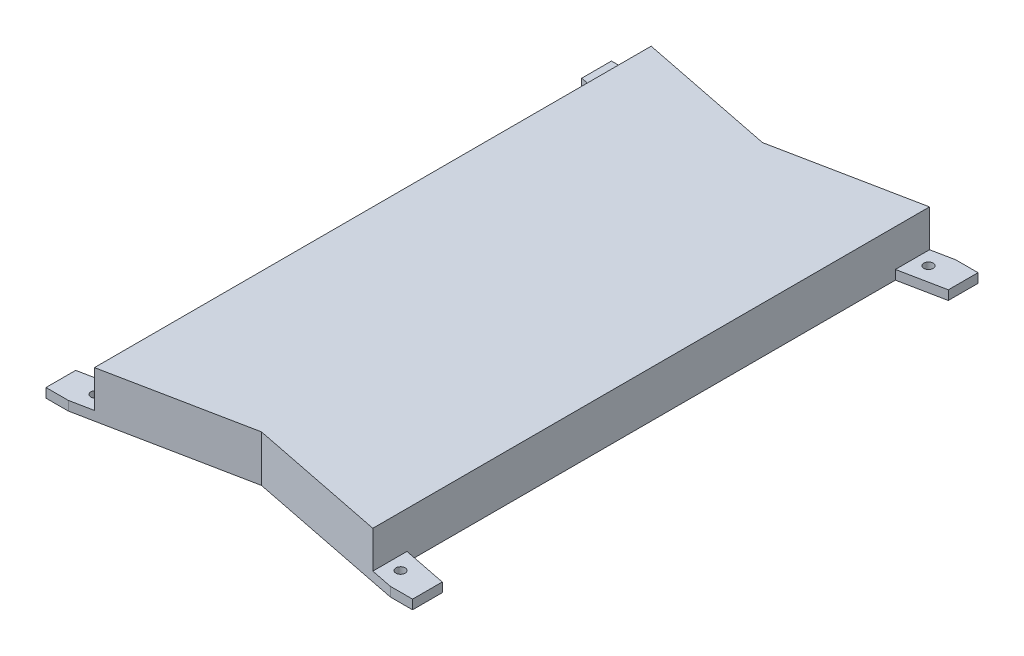
from build123d import *

# Parameters (mm, degrees)
BOSS_EXTRUDE1_DEPTH = 5
SKETCH3_R           = 2.5
CUT_EXTRUDE1_DEPTH  = 182.635543155
BOSS_EXTRUDE2_DEPTH = 20
BOSS_EXTRUDE3_DEPTH = 5


with BuildPart() as part:
    # Sketch1 → Boss-Extrude1 (new body)
    with BuildSketch(Plane(origin=(0, 0, 0), x_dir=(1, 0, 0), z_dir=(0, 1, 0))):
        Polygon((-75, 131.6), (-75, -131.6), (-98.766968108, -136.353393622), (-98.766968108, -152.353393622), (-86.766968108, -152.353393622), (-75, -150), (0, -135), (75, -150), (86.766968108, -152.353393622), (98.766968108, -152.353393622), (98.766968108, -136.353393622), (75, -131.6), (75, 131.6), (98.766968108, 136.353393622), (98.766968108, 152.353393622), (86.766968108, 152.353393622), (75, 150), (0, 135), (-75, 150), (-86.766968108, 152.353393622), (-98.766968108, 152.353393622), (-98.766968108, 136.353393622), align=None)
    extrude(amount=BOSS_EXTRUDE1_DEPTH)

    # Sketch3 → Cut-Extrude1 (cut, through all)
    with BuildSketch(Plane(origin=(0, 5, 0), x_dir=(1, 0, 0), z_dir=(0, 1, 0))):
        Polygon((-73, 147.560392195), (-73, -147.560392195), (0, -132.960392195), (73, -147.560392195), (73, 147.560392195), (0, 132.960392195), align=None)
        with Locations((82.176846176, -142.235369235)):
            Circle(SKETCH3_R)
        with Locations((-82.176846176, -142.235369235)):
            Circle(SKETCH3_R)
        with Locations((-82.176846176, 142.235369235)):
            Circle(SKETCH3_R)
        with Locations((82.176846176, 142.235369235)):
            Circle(SKETCH3_R)
    extrude(amount=-CUT_EXTRUDE1_DEPTH, mode=Mode.SUBTRACT)

    # Sketch4 → Boss-Extrude2 (add)
    with BuildSketch(Plane(origin=(0, 5, 0), x_dir=(1, 0, 0), z_dir=(0, 1, 0))):
        Polygon((-75, 150), (-75, -150), (0, -135), (75, -150), (75, 150), (0, 135), align=None)
        Polygon((0, -132.960392195), (73, -147.560392195), (73, 147.560392195), (0, 132.960392195), (-73, 147.560392195), (-73, -147.560392195), align=None, mode=Mode.SUBTRACT)
    extrude(amount=BOSS_EXTRUDE2_DEPTH)

    # Sketch5 → Boss-Extrude3 (add)
    with BuildSketch(Plane(origin=(0, 25, 0), x_dir=(1, 0, 0), z_dir=(0, 1, 0))):
        Polygon((75, 150), (0, 135), (-75, 150), (-75, -150), (0, -135), (75, -150), align=None)
    extrude(amount=-BOSS_EXTRUDE3_DEPTH)


solid = part.part
